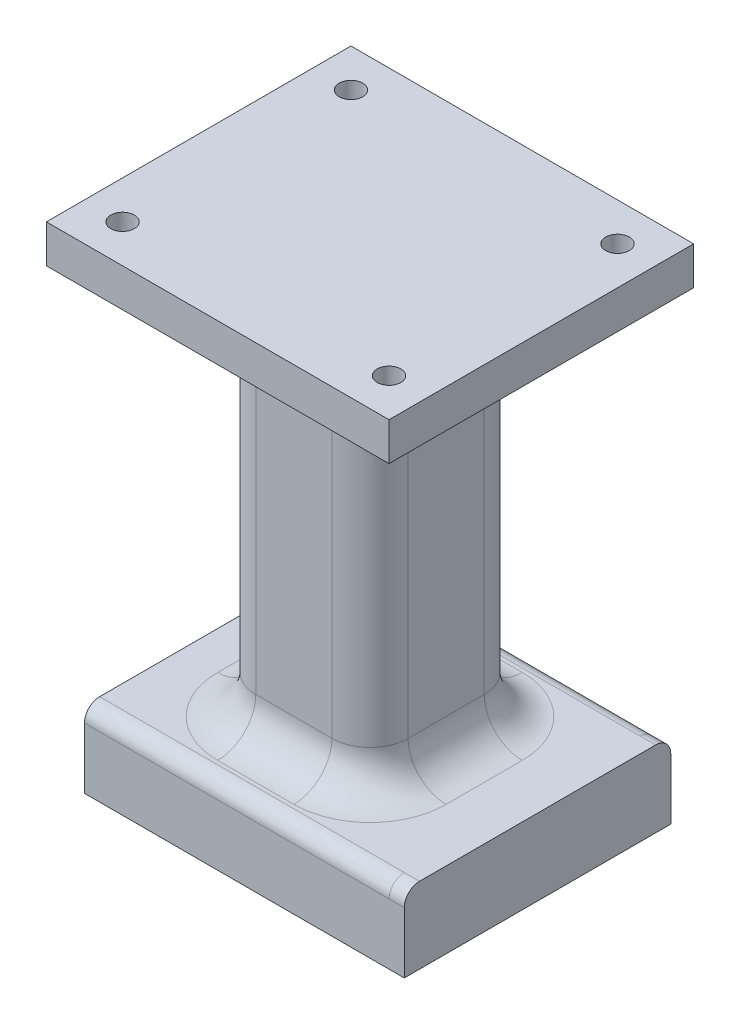
from build123d import *

# Parameters (mm, degrees)
BOSS_EXTRUDE1_DEPTH = 40
BOSS_EXTRUDE2_START = -10
SKETCH2_W           = 20
SKETCH2_H           = 50
BOSS_EXTRUDE2_DEPTH = 20
FILLET1_R           = 5
FILLET2_R           = 2
SKETCH3_W           = 45
SKETCH3_H           = 40
BOSS_EXTRUDE3_DEPTH = 5
FILLET3_R           = 5
SKETCH4_R           = 1.55
CUT_EXTRUDE1_DEPTH  = 5
MIRROR4_START       = 60
MIRROR4_OUTLINE_R   = 1.55
MIRROR4_DEPTH       = 5
SKETCH5_W           = 35
SKETCH5_H           = 10
BOSS_EXTRUDE4_DEPTH = 2
FILLET4_R           = 2


# Read off the part's stored shape, not the designer's step: Mirror4
with BuildPart() as part:
    # Sketch1 → Boss-Extrude1 (new body)
    with BuildSketch(Plane(origin=(0, 0, 0), x_dir=(0, 0, -1), z_dir=(1, 0, 0))):
        Polygon((-11.4, 0), (-17.5, 0), (-17.5, 10), (17.5, 10), (17.5, 0), (11.4, 0), (11.4, 2.35), (13.9, 2.35), (13.9, 7.6), (3.6, 7.6), (3.6, 2.35), (6.1, 2.35), (6.1, 0), (-6.1, 0), (-6.1, 2.35), (-3.6, 2.35), (-3.6, 7.6), (-13.9, 7.6), (-13.9, 2.35), (-11.4, 2.35), align=None)
    extrude(amount=BOSS_EXTRUDE1_DEPTH)

    # Sketch2 → Boss-Extrude2 (add)
    with BuildSketch(Plane(origin=(40, 0, 0), x_dir=(0, 0, -1), z_dir=(1, 0, 0)).offset(BOSS_EXTRUDE2_START)):
        with Locations((0, 35)):
            Rectangle(SKETCH2_W, SKETCH2_H)
    extrude(amount=-BOSS_EXTRUDE2_DEPTH)

    # Fillet1
    fillet1_edges = [part.edges().sort_by_distance(p)[0] for p in [
        (10, 35, 10),
        (20, 10, 10),
        (10, 35, -10),
        (10, 10, 0),
        (20, 10, -10),
        (30, 35, 10),
        (30, 10, 0),
        (30, 35, -10),
    ]]
    fillet(fillet1_edges, radius=FILLET1_R)

    # Fillet2
    fillet2_edges = [part.edges().sort_by_distance(p)[0] for p in [
        (20, 10, 17.5),
        (20, 10, -17.5),
    ]]
    fillet(fillet2_edges, radius=FILLET2_R)

    # Sketch3 → Boss-Extrude3 (add)
    with BuildSketch(Plane(origin=(0, 60, 0), x_dir=(1, 0, 0), z_dir=(0, 1, 0))):
        with Locations((20, 0)):
            Rectangle(SKETCH3_W, SKETCH3_H)
    extrude(amount=BOSS_EXTRUDE3_DEPTH)

    # Fillet3
    fillet3_edges = [part.edges().sort_by_distance(p)[0] for p in [
        (20, 60, 10),
        (30, 60, 0),
        (20, 60, -10),
        (10, 60, 0),
        (28.535533906, 60, 8.535533906),
        (28.535533906, 60, -8.535533906),
        (11.464466094, 60, 8.535533906),
        (11.464466094, 60, -8.535533906),
    ]]
    fillet(fillet3_edges, radius=FILLET3_R)

    # Sketch4 → Cut-Extrude1 (cut)
    with BuildSketch(Plane(origin=(0, 65, 0), x_dir=(1, 0, 0), z_dir=(0, 1, 0))):
        with Locations(Location((2.5, 15, 0), (0, 0, 270))):
            Circle(SKETCH4_R)
    extrude(amount=-CUT_EXTRUDE1_DEPTH, mode=Mode.SUBTRACT)

    # Mirror4 outline → Mirror4 (cut)
    with BuildSketch(Plane(origin=(0, 0, 0), x_dir=(1, 0, 0), z_dir=(0, 1, 0)).offset(MIRROR4_START)):
        with Locations((2.5, -15)):
            Circle(MIRROR4_OUTLINE_R)
        with Locations((37.5, 15)):
            Circle(MIRROR4_OUTLINE_R)
        with Locations((37.5, -15)):
            Circle(MIRROR4_OUTLINE_R)
    extrude(amount=MIRROR4_DEPTH, mode=Mode.SUBTRACT)

    # Sketch5 → Boss-Extrude4 (add)
    with BuildSketch(Plane(origin=(40, 0, 0), x_dir=(0, 0, -1), z_dir=(1, 0, 0))):
        with Locations((0, 5)):
            Rectangle(SKETCH5_W, SKETCH5_H)
    extrude(amount=BOSS_EXTRUDE4_DEPTH)

    # Fillet4
    fillet4_edges = [part.edges().sort_by_distance(p)[0] for p in [
        (41, 10, -17.5),
        (41, 10, 17.5),
    ]]
    fillet(fillet4_edges, radius=FILLET4_R)


solid = part.part
